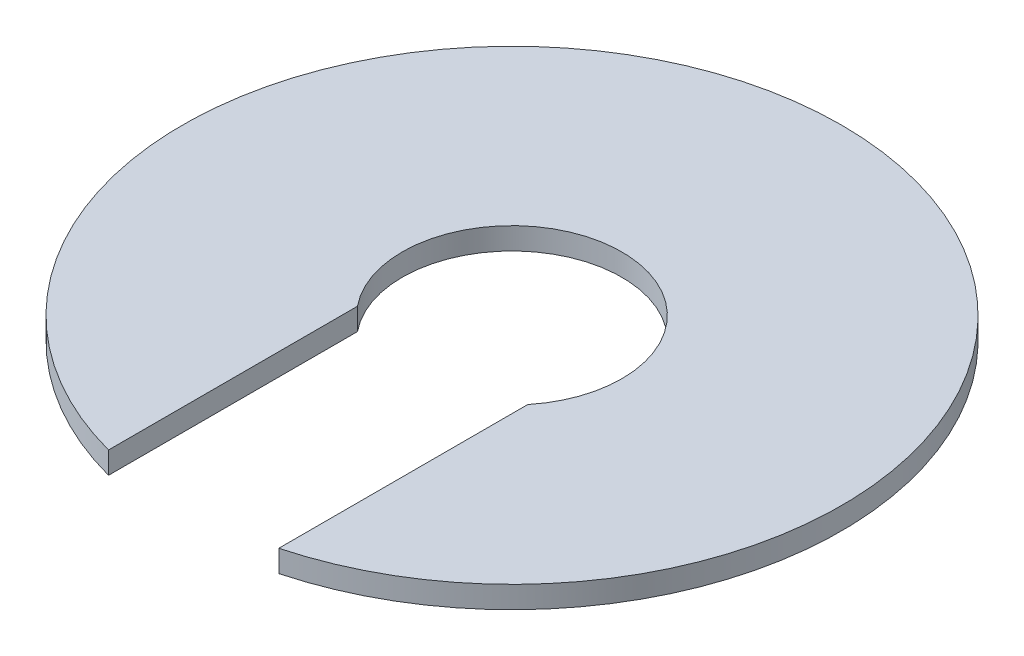
from build123d import *

# Parameters (mm, degrees)
BOSS_EXTRUDE1_DEPTH = 0.254


with BuildPart() as part:
    # Sketch1 → Boss-Extrude1 (new body)
    with BuildSketch(Plane(origin=(0, 0, 0), x_dir=(1, 0, 0), z_dir=(0, 1, 0))):
        with BuildLine():
            Line((-0.984250258, -3.680672687), (-0.984250258, -0.802590449))
            ThreePointArc((-0.984250258, -0.802590449), (0, 1.27), (0.984250258, -0.802590449))
            Line((0.984250258, -0.802590449), (0.984250258, -3.680672687))
            ThreePointArc((0.984250258, -3.680672687), (0, 3.81), (-0.984250258, -3.680672687))
        make_face()
    extrude(amount=BOSS_EXTRUDE1_DEPTH)


solid = part.part
